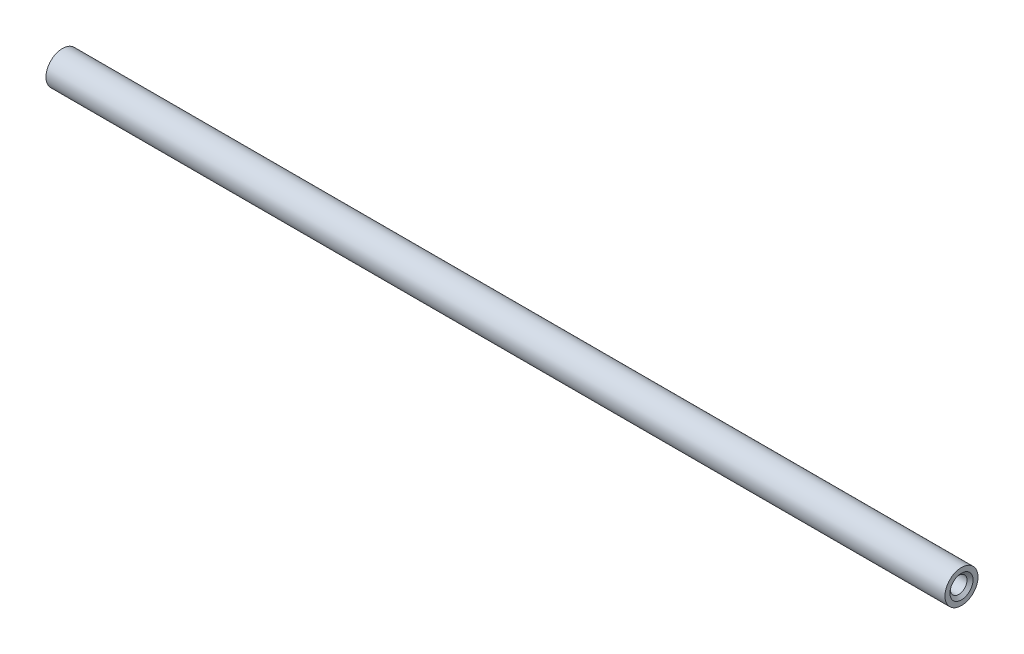
from build123d import *

# Parameters (mm, degrees)
SKETCH1_W                              = 172.72
SKETCH1_H                              = 3.175
F_1_8_0_125_DIAMETER_HOLE1_D           = 3.175
F_1_8_0_125_DIAMETER_HOLE1_DEPTH       = 19.05
F_1_8_0_125_DIAMETER_HOLE1_CSINK_D     = 4.445
F_1_8_0_125_DIAMETER_HOLE1_CSINK_ANGLE = 100
F_1_8_0_125_DIAMETER_HOLE1_TIP         = 0.953866233
F_1_8_0_125_DIAMETER_HOLE3_D           = 3.175
F_1_8_0_125_DIAMETER_HOLE3_DEPTH       = 19.05
F_1_8_0_125_DIAMETER_HOLE3_CSINK_D     = 4.445
F_1_8_0_125_DIAMETER_HOLE3_CSINK_ANGLE = 100
F_1_8_0_125_DIAMETER_HOLE3_TIP         = 0.953866233


with BuildPart() as part:
    # Sketch1 → Revolve3 (revolve)
    with BuildSketch(Plane(origin=(0, 0, 0), x_dir=(1, 0, 0), z_dir=(0, 1, 0))):
        with Locations((-86.36, 1.5875)):
            Rectangle(SKETCH1_W, SKETCH1_H)
    revolve(axis=Axis((0, 0, -3.175), (-1, 0, 0)))

    # 1/8 (0.125) Diameter Hole1
    with Locations(Plane.ZY.offset(172.72)):
        with Locations((-3.175, 0)):
            CounterSinkHole(F_1_8_0_125_DIAMETER_HOLE1_D / 2, F_1_8_0_125_DIAMETER_HOLE1_CSINK_D / 2, depth=F_1_8_0_125_DIAMETER_HOLE1_DEPTH, counter_sink_angle=F_1_8_0_125_DIAMETER_HOLE1_CSINK_ANGLE)
            with Locations((0, 0, -(F_1_8_0_125_DIAMETER_HOLE1_DEPTH + F_1_8_0_125_DIAMETER_HOLE1_TIP / 2))):  # 118° drill point
                Cone(0, F_1_8_0_125_DIAMETER_HOLE1_D / 2, F_1_8_0_125_DIAMETER_HOLE1_TIP, mode=Mode.SUBTRACT)

    # 1/8 (0.125) Diameter Hole3
    with Locations(Plane(origin=(0, 0, 0), x_dir=(0, 0, -1), z_dir=(1, 0, 0))):
        with Locations((3.175, 0)):
            CounterSinkHole(F_1_8_0_125_DIAMETER_HOLE3_D / 2, F_1_8_0_125_DIAMETER_HOLE3_CSINK_D / 2, depth=F_1_8_0_125_DIAMETER_HOLE3_DEPTH, counter_sink_angle=F_1_8_0_125_DIAMETER_HOLE3_CSINK_ANGLE)
            with Locations((0, 0, -(F_1_8_0_125_DIAMETER_HOLE3_DEPTH + F_1_8_0_125_DIAMETER_HOLE3_TIP / 2))):  # 118° drill point
                Cone(0, F_1_8_0_125_DIAMETER_HOLE3_D / 2, F_1_8_0_125_DIAMETER_HOLE3_TIP, mode=Mode.SUBTRACT)


solid = part.part
